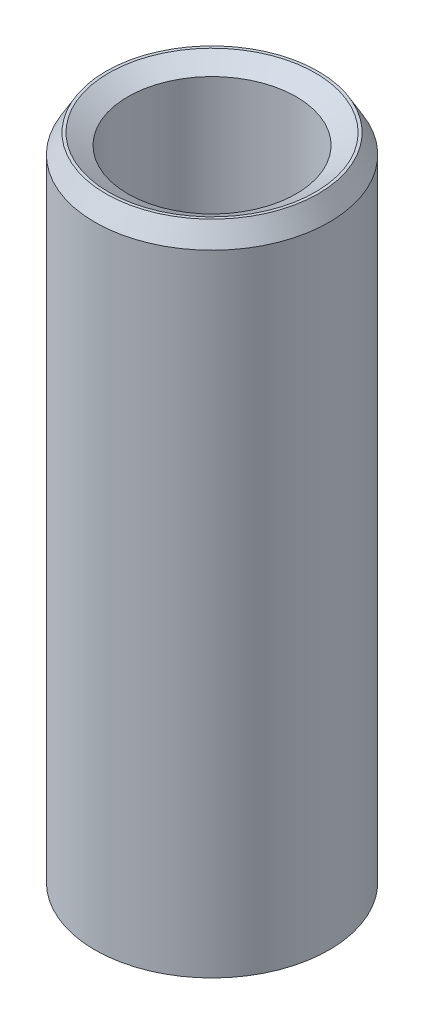
from build123d import *
from OCP.BRepFilletAPI import BRepFilletAPI_MakeChamfer

# Parameters (mm, degrees)
SKETCH1_R           = 10
BOSS_EXTRUDE1_DEPTH = 56.363973734
SKETCH2_R           = 7.185418221
CUT_EXTRUDE1_DEPTH  = 59.11107928
CHAMFER1_SIZE       = 1.63113458
CHAMFER1_SIZE2      = 0.941735989


with BuildPart() as part:
    # Sketch1 → Boss-Extrude1 (new body)
    with BuildSketch(Plane(origin=(0, 0, 0), x_dir=(1, 0, 0), z_dir=(0, 1, 0))):
        Circle(SKETCH1_R)
    extrude(amount=BOSS_EXTRUDE1_DEPTH)

    # Sketch2 → Cut-Extrude1 (cut, through all)
    with BuildSketch(Plane(origin=(0, 0, 0), x_dir=(1, 0, 0), z_dir=(0, 1, 0))):
        Circle(SKETCH2_R)
    extrude(amount=CUT_EXTRUDE1_DEPTH, mode=Mode.SUBTRACT)

    # Chamfer1: one chamfer whose edges measure the first distance from different faces: ONE call of the kernel's chamfer builder (chamfer() names one face for all edges)
    chamfer1_edges_1 = [part.edges().sort_by_distance(p)[0] for p in [
        (-7.185418221, 56.363973734, 0),
    ]]
    chamfer1_side_1 = [part.faces().sort_by_distance(p)[0] for p in [
        (-9.717157288, 56.363973734, 0),
    ]]
    chamfer1_edges_2 = [part.edges().sort_by_distance(p)[0] for p in [
        (-7.185418221, 0, 0),
    ]]
    chamfer1_side_2 = [part.faces().sort_by_distance(p)[0] for p in [
        (-7.185418221, 28.181986867, 0),
    ]]
    chamfer1_edges_3 = [part.edges().sort_by_distance(p)[0] for p in [
        (-10, 0, 0),
    ]]
    chamfer1_side_3 = [part.faces().sort_by_distance(p)[0] for p in [
        (-9.717157288, 0, 0),
    ]]
    chamfer1_edges_4 = [part.edges().sort_by_distance(p)[0] for p in [
        (-10, 56.363973734, 0),
    ]]
    chamfer1_side_4 = [part.faces().sort_by_distance(p)[0] for p in [
        (-10, 28.181986867, 0),
    ]]
    chamfer1 = BRepFilletAPI_MakeChamfer(part.part.solid().wrapped)
    for e in chamfer1_edges_1:
        chamfer1.Add(CHAMFER1_SIZE, CHAMFER1_SIZE2, e.wrapped, chamfer1_side_1[0].wrapped)  # the first distance lies on this face
    for e in chamfer1_edges_2:
        chamfer1.Add(CHAMFER1_SIZE, CHAMFER1_SIZE2, e.wrapped, chamfer1_side_2[0].wrapped)  # the first distance lies on this face
    for e in chamfer1_edges_3:
        chamfer1.Add(CHAMFER1_SIZE, CHAMFER1_SIZE2, e.wrapped, chamfer1_side_3[0].wrapped)  # the first distance lies on this face
    for e in chamfer1_edges_4:
        chamfer1.Add(CHAMFER1_SIZE, CHAMFER1_SIZE2, e.wrapped, chamfer1_side_4[0].wrapped)  # the first distance lies on this face
    add(Compound.cast(chamfer1.Shape()), mode=Mode.REPLACE)


solid = part.part
